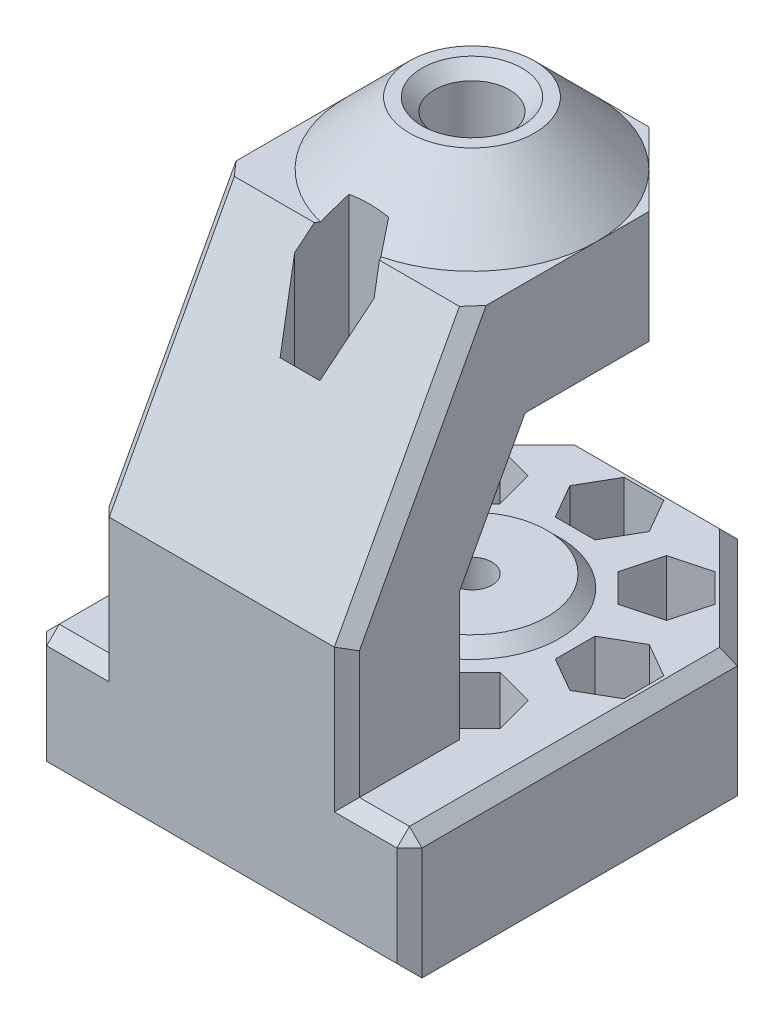
from build123d import *
from OCP.BRepFilletAPI import BRepFilletAPI_MakeChamfer

# Parameters (mm, degrees)
CROQUIS1_R              = 1.6
SALIENTE_EXTRUIR1_DEPTH = 10
SALIENTE_EXTRUIR2_DEPTH = 30
CROQUIS12_W             = 12.426406872
CROQUIS12_H             = 4.855948251
CORTAR_EXTRUIR7_DEPTH   = 3.5
CROQUIS3_OUTSIDE_W      = 44.076
CROQUIS3_OUTSIDE_H      = 49.076
CROQUIS3_OUTSIDE_R      = 1.6
CORTAR_EXTRUIR1_DEPTH   = 29
CROQUIS4_R              = 10
SALIENTE_EXTRUIR3_DEPTH = 5
CHAFL_N1_SIZE           = 5
CROQUIS6_R              = 1.6
CORTAR_EXTRUIR3_DEPTH   = 10
CROQUIS8_R              = 6
CROQUIS8_R_2            = 1.6
SALIENTE_EXTRUIR4_DEPTH = 1
CHAFL_N2_SIZE           = 1
CROQUIS5_R              = 3
CORTAR_EXTRUIR4_DEPTH   = 33
CHAFL_N3_SIZE           = 1
CHAFL_N3_SIZE2          = 1.000027611
CHAFL_N3_SIZE2_2        = 1.000000257
CHAFL_N3_SIZE2_3        = 0.999999743
CHAFL_N3_SIZE2_4        = 0.999999708
CHAFL_N3_SIZE2_5        = 1.000000292
CHAFL_N3_SIZE2_6        = 0.999968652
CHAFL_N3_SIZE2_7        = 0.999972392
CHAFL_N3_SIZE2_8        = 1.000031351
CORTAR_EXTRUIR5_START   = -5
CORTAR_EXTRUIR5_DEPTH   = 15
CORTAR_EXTRUIR8_DEPTH   = 48.759815826
CHAFL_N4_SIZE           = 1
CORTAR_EXTRUIR6_DEPTH   = 3.5


with BuildPart() as part:
    # Croquis1 → Saliente-Extruir1 (new body)
    with BuildSketch(Plane(origin=(0, 0, 0), x_dir=(1, 0, 0), z_dir=(0, 1, 0))):
        Polygon((-15, -6.213203436), (-15, -20), (15, -20), (15, -6.213203436), (15, 6.213203436), (6.213203436, 15), (-6.213203436, 15), (-15, 6.213203436), align=None)
        with Locations(Location((0, 0, 0), (0, 0, 270))):
            Circle(CROQUIS1_R, mode=Mode.SUBTRACT)
    extrude(amount=SALIENTE_EXTRUIR1_DEPTH)

    # Croquis2 → Saliente-Extruir2 (add)
    with BuildSketch(Plane.ZY.offset(15)):
        Polygon((10, 20), (4.621471258, 30), (-10, 30), (-10, 39), (10, 39), (20, 20.407554966), (20, 10), (10, 10), align=None)
    extrude(amount=-SALIENTE_EXTRUIR2_DEPTH)

    # Croquis12 → Cortar-Extruir7 (cut)
    with BuildSketch(Plane(origin=(0, 0, 10), x_dir=(-1, 0, 0), z_dir=(0, 0, -1))):
        with Locations((0, 12.427974126)):
            Rectangle(CROQUIS12_W, CROQUIS12_H)
    extrude(amount=-CORTAR_EXTRUIR7_DEPTH, mode=Mode.SUBTRACT)

    # Croquis3 outside → Cortar-Extruir1 (cut)
    # profile 1 of 2: a face of its own
    with BuildSketch(Plane(origin=(0, 39, 0), x_dir=(1, 0, 0), z_dir=(0, 1, 0))):
        with Locations((0, -2.5)):
            Rectangle(CROQUIS3_OUTSIDE_W, CROQUIS3_OUTSIDE_H)
        Polygon((-10, -4.142135624), (-9.999502859, -20), (9.999995364, -20), (10, -4.142135624), (10, 4.142135624), (4.142135624, 10), (-4.142135624, 10), (-10, 4.142135624), align=None, mode=Mode.SUBTRACT)
    # profile 2 of 2: a face of its own
    with BuildSketch(Plane(origin=(0, 39, 0), x_dir=(1, 0, 0), z_dir=(0, 1, 0))):
        with Locations(Location((0, 0, 0), (0, 0, 270))):
            Circle(CROQUIS3_OUTSIDE_R)
    extrude(amount=-CORTAR_EXTRUIR1_DEPTH, mode=Mode.SUBTRACT)

    # Croquis4 → Saliente-Extruir3 (add)
    with BuildSketch(Plane(origin=(0, 39, 0), x_dir=(1, 0, 0), z_dir=(0, 1, 0))):
        with Locations(Location((0, 0, 0), (0, 0, 270))):
            Circle(CROQUIS4_R)
    extrude(amount=SALIENTE_EXTRUIR3_DEPTH)

    # Chaflán1
    chafl_n1_edges = [part.edges().sort_by_distance(p)[0] for p in [
        (0, 44, -10),
    ]]
    chamfer(chafl_n1_edges, length=CHAFL_N1_SIZE - 0.0001)  # a hair under: the kernel refuses the full size

    # Croquis6 → Cortar-Extruir3 (cut)
    with BuildSketch(Plane.XZ):
        with Locations(Location((0, 11, 0), (0, 0, 270))):
            Circle(CROQUIS6_R)
        with Locations(Location((7.778174593, 7.778174593, 0), (0, 0, 270))):
            Circle(CROQUIS6_R)
        with Locations(Location((11, 0, 0), (0, 0, 270))):
            Circle(CROQUIS6_R)
        with Locations(Location((7.778174593, -7.778174593, 0), (0, 0, 270))):
            Circle(CROQUIS6_R)
        with Locations(Location((0, -11, 0), (0, 0, 270))):
            Circle(CROQUIS6_R)
        with Locations(Location((-7.778174593, -7.778174593, 0), (0, 0, 270))):
            Circle(CROQUIS6_R)
        with Locations(Location((-11, 0, 0), (0, 0, 270))):
            Circle(CROQUIS6_R)
        with Locations(Location((-7.778174593, 7.778174593, 0), (0, 0, 270))):
            Circle(CROQUIS6_R)
    extrude(amount=-CORTAR_EXTRUIR3_DEPTH, mode=Mode.SUBTRACT)

    # Croquis8 → Saliente-Extruir4 (add)
    with BuildSketch(Plane(origin=(0, 10, 0), x_dir=(1, 0, 0), z_dir=(0, 1, 0))):
        with Locations(Location((0, 0, 0), (0, 0, 270))):
            Circle(CROQUIS8_R)
        with Locations(Location((0, 0, 0), (0, 0, 270))):
            Circle(CROQUIS8_R_2, mode=Mode.SUBTRACT)
    extrude(amount=SALIENTE_EXTRUIR4_DEPTH)

    # Chaflán2
    chafl_n2_edges = [part.edges().sort_by_distance(p)[0] for p in [
        (0, 10, -6),
    ]]
    chamfer(chafl_n2_edges, length=CHAFL_N2_SIZE - 0.0001)  # a hair under: the kernel refuses the full size

    # Croquis5 → Cortar-Extruir4 (cut)
    with BuildSketch(Plane(origin=(0, 44, 0), x_dir=(1, 0, 0), z_dir=(0, 1, 0))):
        with Locations(Location((0, 0, 0), (0, 0, 270))):
            Circle(CROQUIS5_R)
    extrude(amount=-CORTAR_EXTRUIR4_DEPTH, mode=Mode.SUBTRACT)

    # Chaflán3: one chamfer whose edges measure the first distance from different faces: ONE call of the kernel's chamfer builder (chamfer() names one face for all edges)
    chafl_n3_edges_1 = [part.edges().sort_by_distance(p)[0] for p in [
        (10.606601718, 10, -10.606601718),
        (0, 10, -15),
        (-10.606601718, 10, -10.606601718),
        (-15, 10, 6.893398282),
        (15, 10, 6.893398282),
        (15, 5, 20),
        (-15, 5, 20),
        (0, 0, 20),
        (-12.499751429, 10, 20),
        (12.499997682, 10, 20),
    ]]
    chafl_n3_edges_2 = [part.edges().sort_by_distance(p)[0] for p in [
        (-9.999659608, 29.703777483, 15),
    ]]
    chafl_n3_side_2 = [part.faces().sort_by_distance(p)[0] for p in [
        (-9.999745235, 23.826424788, 12.268639946),
    ]]
    chafl_n3_edges_3 = [part.edges().sort_by_distance(p)[0] for p in [
        (9.999996825, 29.703777483, 15),
    ]]
    chafl_n3_side_3 = [part.faces().sort_by_distance(p)[0] for p in [
        (9.999997624, 23.826424788, 12.268639946),
    ]]
    chafl_n3_edges_4 = [part.edges().sort_by_distance(p)[0] for p in [
        (9.999999074, 25, 7.310735629),
    ]]
    chafl_n3_side_4 = [part.faces().sort_by_distance(p)[0] for p in [
        (9.999997624, 23.826424788, 12.268639946),
    ]]
    chafl_n3_edges_5 = [part.edges().sort_by_distance(p)[0] for p in [
        (9.999998287, 15, 10),
    ]]
    chafl_n3_side_5 = [part.faces().sort_by_distance(p)[0] for p in [
        (0.000130269, 16.111309081, 10),
    ]]
    chafl_n3_edges_6 = [part.edges().sort_by_distance(p)[0] for p in [
        (9.999995364, 15.203777483, 20),
    ]]
    chafl_n3_side_6 = [part.faces().sort_by_distance(p)[0] for p in [
        (0.00010087, 9.179654523, 20),
    ]]
    chafl_n3_edges_7 = [part.edges().sort_by_distance(p)[0] for p in [
        (-9.999816357, 15, 10),
    ]]
    chafl_n3_side_7 = [part.faces().sort_by_distance(p)[0] for p in [
        (-9.999745235, 23.826424788, 12.268639946),
    ]]
    chafl_n3_edges_8 = [part.edges().sort_by_distance(p)[0] for p in [
        (-9.999900665, 25, 7.310735629),
    ]]
    chafl_n3_side_8 = [part.faces().sort_by_distance(p)[0] for p in [
        (-9.999745235, 23.826424788, 12.268639946),
    ]]
    chafl_n3_edges_9 = [part.edges().sort_by_distance(p)[0] for p in [
        (-9.999502859, 15.203777483, 20),
    ]]
    chafl_n3_side_9 = [part.faces().sort_by_distance(p)[0] for p in [
        (-9.999745235, 23.826424788, 12.268639946),
    ]]
    chafl_n3 = BRepFilletAPI_MakeChamfer(part.part.solid().wrapped)
    for e in chafl_n3_edges_1:
        chafl_n3.Add(CHAFL_N3_SIZE, e.wrapped)
    for e in chafl_n3_edges_2:
        chafl_n3.Add(CHAFL_N3_SIZE, CHAFL_N3_SIZE2, e.wrapped, chafl_n3_side_2[0].wrapped)  # the first distance lies on this face
    for e in chafl_n3_edges_3:
        chafl_n3.Add(CHAFL_N3_SIZE, CHAFL_N3_SIZE2_2, e.wrapped, chafl_n3_side_3[0].wrapped)  # the first distance lies on this face
    for e in chafl_n3_edges_4:
        chafl_n3.Add(CHAFL_N3_SIZE, CHAFL_N3_SIZE2_3, e.wrapped, chafl_n3_side_4[0].wrapped)  # the first distance lies on this face
    for e in chafl_n3_edges_5:
        chafl_n3.Add(CHAFL_N3_SIZE, CHAFL_N3_SIZE2_4, e.wrapped, chafl_n3_side_5[0].wrapped)  # the first distance lies on this face
    for e in chafl_n3_edges_6:
        chafl_n3.Add(CHAFL_N3_SIZE, CHAFL_N3_SIZE2_5, e.wrapped, chafl_n3_side_6[0].wrapped)  # the first distance lies on this face
    for e in chafl_n3_edges_7:
        chafl_n3.Add(CHAFL_N3_SIZE, CHAFL_N3_SIZE2_6, e.wrapped, chafl_n3_side_7[0].wrapped)  # the first distance lies on this face
    for e in chafl_n3_edges_8:
        chafl_n3.Add(CHAFL_N3_SIZE, CHAFL_N3_SIZE2_7, e.wrapped, chafl_n3_side_8[0].wrapped)  # the first distance lies on this face
    for e in chafl_n3_edges_9:
        chafl_n3.Add(CHAFL_N3_SIZE, CHAFL_N3_SIZE2_8, e.wrapped, chafl_n3_side_9[0].wrapped)  # the first distance lies on this face
    add(Compound.cast(chafl_n3.Shape()), mode=Mode.REPLACE)

    # Croquis9 → Cortar-Extruir5 (cut)
    with BuildSketch(Plane.XZ.offset(CORTAR_EXTRUIR5_START)):
        Polygon((-10.023540191, -5.532808996), (-10.84540104, -8.600035443), (-8.600035443, -10.84540104), (-5.532808995, -10.023540191), (-4.710948146, -6.956313744), (-6.956313744, -4.710948146), align=None)
        Polygon((-3.175426481, -11), (-1.58771324, -13.75), (1.58771324, -13.75), (3.175426481, -11), (1.58771324, -8.25), (-1.58771324, -8.25), align=None)
        Polygon((-11, 3.175426481), (-13.75, 1.58771324), (-13.75, -1.58771324), (-11, -3.175426481), (-8.25, -1.58771324), (-8.25, 1.58771324), align=None)
        Polygon((-5.532808996, 10.023540191), (-8.600035443, 10.84540104), (-10.84540104, 8.600035443), (-10.023540191, 5.532808995), (-6.956313744, 4.710948146), (-4.710948146, 6.956313744), align=None)
        Polygon((3.175426481, 11), (1.58771324, 13.75), (-1.58771324, 13.75), (-3.175426481, 11), (-1.58771324, 8.25), (1.58771324, 8.25), align=None)
        Polygon((10.023540191, 5.532808996), (10.84540104, 8.600035443), (8.600035443, 10.84540104), (5.532808995, 10.023540191), (4.710948146, 6.956313744), (6.956313744, 4.710948146), align=None)
        Polygon((11, -3.175426481), (13.75, -1.58771324), (13.75, 1.58771324), (11, 3.175426481), (8.25, 1.58771324), (8.25, -1.58771324), align=None)
        Polygon((5.532808996, -10.023540191), (8.600035443, -10.84540104), (10.84540104, -8.600035443), (10.023540191, -5.532808995), (6.956313744, -4.710948146), (4.710948146, -6.956313744), align=None)
    extrude(amount=-CORTAR_EXTRUIR5_DEPTH, mode=Mode.SUBTRACT)

    # Croquis13 → Cortar-Extruir8 (cut, through all)
    with BuildSketch(Plane(origin=(0, 10, -10), x_dir=(-1, 0, 0), z_dir=(0, -1, 0))):
        Polygon((-3.175426481, -21), (-1.58771324, -23.75), (1.58771324, -23.75), (3.175426481, -21), (1.58771324, -18.25), (-1.58771324, -18.25), align=None)
    extrude(amount=-CORTAR_EXTRUIR8_DEPTH, mode=Mode.SUBTRACT)

    # Chaflán4
    chafl_n4_edges = [part.edges().sort_by_distance(p)[0] for p in [
        (0, 44, -3),
    ]]
    chamfer(chafl_n4_edges, length=CHAFL_N4_SIZE)

    # Croquis10 → Cortar-Extruir6 (cut)
    with BuildSketch(Plane.XZ):
        Polygon((3.175426481, 0), (1.58771324, 2.75), (-1.58771324, 2.75), (-3.175426481, 0), (-1.58771324, -2.75), (1.58771324, -2.75), align=None)
    extrude(amount=-CORTAR_EXTRUIR6_DEPTH, mode=Mode.SUBTRACT)


solid = part.part
